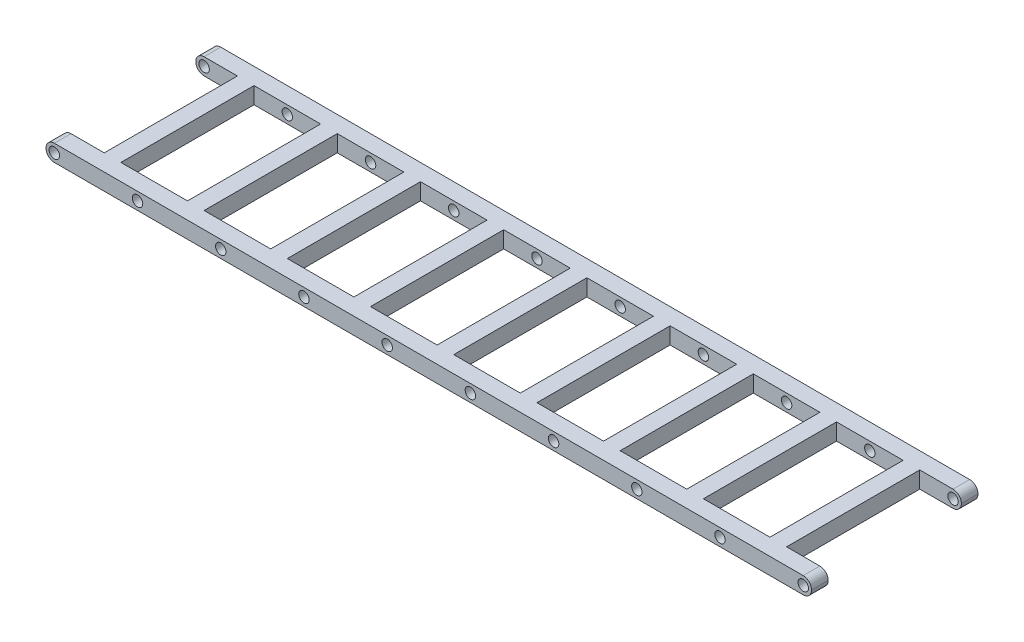
from build123d import *

# Parameters (mm, degrees)
SKETCH1_W           = 25.4
SKETCH1_H           = 50.8
BOSS_EXTRUDE1_DEPTH = 6.35
CUT_EXTRUDE1_REACH  = 161.384
SKETCH2_R           = 1.9939
FILLET2_R           = 3.175


with BuildPart() as part:
    # Sketch1 → Boss-Extrude1 (new body)
    with BuildSketch(Plane(origin=(0, 0, 0), x_dir=(1, 0, 0), z_dir=(0, 1, 0))):
        Polygon((-146.05, 25.4), (-130.175, 25.4), (-130.175, -25.4), (-146.05, -25.4), (-146.05, -31.75), (146.05, -31.75), (146.05, -25.4), (130.175, -25.4), (130.175, 25.4), (146.05, 25.4), (146.05, 31.75), (-146.05, 31.75), align=None)
        with Locations((-15.875, 0)):
            Rectangle(SKETCH1_W, SKETCH1_H, mode=Mode.SUBTRACT)
        with Locations((111.125, 0)):
            Rectangle(SKETCH1_W, SKETCH1_H, mode=Mode.SUBTRACT)
        with Locations((-47.625, 0)):
            Rectangle(SKETCH1_W, SKETCH1_H, mode=Mode.SUBTRACT)
        with Locations((-79.375, 0)):
            Rectangle(SKETCH1_W, SKETCH1_H, mode=Mode.SUBTRACT)
        with Locations((-111.125, 0)):
            Rectangle(SKETCH1_W, SKETCH1_H, mode=Mode.SUBTRACT)
        with Locations((79.375, 0)):
            Rectangle(SKETCH1_W, SKETCH1_H, mode=Mode.SUBTRACT)
        with Locations((47.625, 0)):
            Rectangle(SKETCH1_W, SKETCH1_H, mode=Mode.SUBTRACT)
        with Locations((15.875, 0)):
            Rectangle(SKETCH1_W, SKETCH1_H, mode=Mode.SUBTRACT)
    extrude(amount=-BOSS_EXTRUDE1_DEPTH)

    # Cut-Extrude1: up to this face of the body (flat: up to its plane)
    cut_extrude1_end = Plane(part.part.faces().sort_by_distance((0, -3.175, -31.75))[0])
    # Sketch2 → Cut-Extrude1 (cut, up to the picked face)
    with BuildSketch(Plane.XY.offset(31.75), mode=Mode.PRIVATE) as cut_extrude1_sk1:
        with Locations((-142.875, -3.175)):
            Circle(SKETCH2_R)
    cut_extrude1_tool1 = split(extrude(cut_extrude1_sk1.sketch, amount=-CUT_EXTRUDE1_REACH, mode=Mode.PRIVATE), bisect_by=cut_extrude1_end, keep=Keep.BOTH, mode=Mode.PRIVATE)
    # Sketch2 → Cut-Extrude1 (cut, up to the picked face)
    with BuildSketch(Plane.XY.offset(31.75), mode=Mode.PRIVATE) as cut_extrude1_sk2:
        with Locations((-111.125, -3.175)):
            Circle(SKETCH2_R)
    cut_extrude1_tool2 = split(extrude(cut_extrude1_sk2.sketch, amount=-CUT_EXTRUDE1_REACH, mode=Mode.PRIVATE), bisect_by=cut_extrude1_end, keep=Keep.BOTH, mode=Mode.PRIVATE)
    # Sketch2 → Cut-Extrude1 (cut, up to the picked face)
    with BuildSketch(Plane.XY.offset(31.75), mode=Mode.PRIVATE) as cut_extrude1_sk3:
        with Locations((-79.375, -3.175)):
            Circle(SKETCH2_R)
    cut_extrude1_tool3 = split(extrude(cut_extrude1_sk3.sketch, amount=-CUT_EXTRUDE1_REACH, mode=Mode.PRIVATE), bisect_by=cut_extrude1_end, keep=Keep.BOTH, mode=Mode.PRIVATE)
    # Sketch2 → Cut-Extrude1 (cut, up to the picked face)
    with BuildSketch(Plane.XY.offset(31.75), mode=Mode.PRIVATE) as cut_extrude1_sk4:
        with Locations((-47.625, -3.175)):
            Circle(SKETCH2_R)
    cut_extrude1_tool4 = split(extrude(cut_extrude1_sk4.sketch, amount=-CUT_EXTRUDE1_REACH, mode=Mode.PRIVATE), bisect_by=cut_extrude1_end, keep=Keep.BOTH, mode=Mode.PRIVATE)
    # Sketch2 → Cut-Extrude1 (cut, up to the picked face)
    with BuildSketch(Plane.XY.offset(31.75), mode=Mode.PRIVATE) as cut_extrude1_sk5:
        with Locations((-15.875, -3.175)):
            Circle(SKETCH2_R)
    cut_extrude1_tool5 = split(extrude(cut_extrude1_sk5.sketch, amount=-CUT_EXTRUDE1_REACH, mode=Mode.PRIVATE), bisect_by=cut_extrude1_end, keep=Keep.BOTH, mode=Mode.PRIVATE)
    # Sketch2 → Cut-Extrude1 (cut, up to the picked face)
    with BuildSketch(Plane.XY.offset(31.75), mode=Mode.PRIVATE) as cut_extrude1_sk6:
        with Locations((15.875, -3.175)):
            Circle(SKETCH2_R)
    cut_extrude1_tool6 = split(extrude(cut_extrude1_sk6.sketch, amount=-CUT_EXTRUDE1_REACH, mode=Mode.PRIVATE), bisect_by=cut_extrude1_end, keep=Keep.BOTH, mode=Mode.PRIVATE)
    # Sketch2 → Cut-Extrude1 (cut, up to the picked face)
    with BuildSketch(Plane.XY.offset(31.75), mode=Mode.PRIVATE) as cut_extrude1_sk7:
        with Locations((47.625, -3.175)):
            Circle(SKETCH2_R)
    cut_extrude1_tool7 = split(extrude(cut_extrude1_sk7.sketch, amount=-CUT_EXTRUDE1_REACH, mode=Mode.PRIVATE), bisect_by=cut_extrude1_end, keep=Keep.BOTH, mode=Mode.PRIVATE)
    # Sketch2 → Cut-Extrude1 (cut, up to the picked face)
    with BuildSketch(Plane.XY.offset(31.75), mode=Mode.PRIVATE) as cut_extrude1_sk8:
        with Locations((79.375, -3.175)):
            Circle(SKETCH2_R)
    cut_extrude1_tool8 = split(extrude(cut_extrude1_sk8.sketch, amount=-CUT_EXTRUDE1_REACH, mode=Mode.PRIVATE), bisect_by=cut_extrude1_end, keep=Keep.BOTH, mode=Mode.PRIVATE)
    # Sketch2 → Cut-Extrude1 (cut, up to the picked face)
    with BuildSketch(Plane.XY.offset(31.75), mode=Mode.PRIVATE) as cut_extrude1_sk9:
        with Locations((111.125, -3.175)):
            Circle(SKETCH2_R)
    cut_extrude1_tool9 = split(extrude(cut_extrude1_sk9.sketch, amount=-CUT_EXTRUDE1_REACH, mode=Mode.PRIVATE), bisect_by=cut_extrude1_end, keep=Keep.BOTH, mode=Mode.PRIVATE)
    # Sketch2 → Cut-Extrude1 (cut, up to the picked face)
    with BuildSketch(Plane.XY.offset(31.75), mode=Mode.PRIVATE) as cut_extrude1_sk10:
        with Locations((142.875, -3.175)):
            Circle(SKETCH2_R)
    cut_extrude1_tool10 = split(extrude(cut_extrude1_sk10.sketch, amount=-CUT_EXTRUDE1_REACH, mode=Mode.PRIVATE), bisect_by=cut_extrude1_end, keep=Keep.BOTH, mode=Mode.PRIVATE)
    add(cut_extrude1_tool1.solids().sort_by(Axis((-142.875, -3.175, 31.75), (0, 0, -1)))[0], mode=Mode.SUBTRACT)
    add(cut_extrude1_tool2.solids().sort_by(Axis((-111.125, -3.175, 31.75), (0, 0, -1)))[0], mode=Mode.SUBTRACT)
    add(cut_extrude1_tool3.solids().sort_by(Axis((-79.375, -3.175, 31.75), (0, 0, -1)))[0], mode=Mode.SUBTRACT)
    add(cut_extrude1_tool4.solids().sort_by(Axis((-47.625, -3.175, 31.75), (0, 0, -1)))[0], mode=Mode.SUBTRACT)
    add(cut_extrude1_tool5.solids().sort_by(Axis((-15.875, -3.175, 31.75), (0, 0, -1)))[0], mode=Mode.SUBTRACT)
    add(cut_extrude1_tool6.solids().sort_by(Axis((15.875, -3.175, 31.75), (0, 0, -1)))[0], mode=Mode.SUBTRACT)
    add(cut_extrude1_tool7.solids().sort_by(Axis((47.625, -3.175, 31.75), (0, 0, -1)))[0], mode=Mode.SUBTRACT)
    add(cut_extrude1_tool8.solids().sort_by(Axis((79.375, -3.175, 31.75), (0, 0, -1)))[0], mode=Mode.SUBTRACT)
    add(cut_extrude1_tool9.solids().sort_by(Axis((111.125, -3.175, 31.75), (0, 0, -1)))[0], mode=Mode.SUBTRACT)
    add(cut_extrude1_tool10.solids().sort_by(Axis((142.875, -3.175, 31.75), (0, 0, -1)))[0], mode=Mode.SUBTRACT)

    # Fillet2
    fillet2_edges = [part.edges().sort_by_distance(p)[0] for p in [
        (-146.05, -6.35, 28.575),
        (-146.05, 0, 28.575),
        (-146.05, -6.35, -28.575),
        (-146.05, 0, -28.575),
        (146.05, -6.35, -28.575),
        (146.05, 0, -28.575),
        (146.05, -6.35, 28.575),
        (146.05, 0, 28.575),
    ]]
    fillet(fillet2_edges, radius=FILLET2_R - 0.0001)  # a hair under: the kernel refuses the full size


solid = part.part
